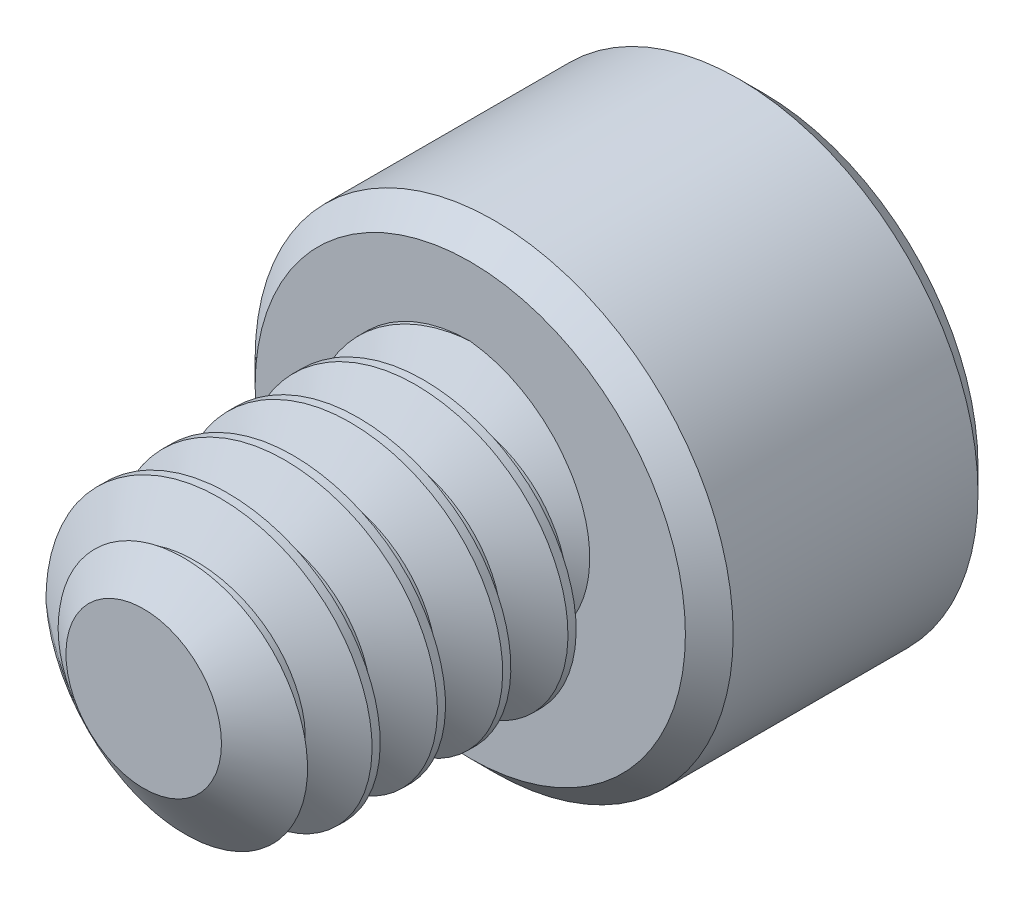
from build123d import *

# Parameters (mm, degrees)
SKETCH1_R          = 1.4224
EXTRUDE1_DEPTH     = 3.175
CUT_SWEEP1_PITCH   = 0.635
SKETCH6_R          = 2.3241
EXTRUDE2_DEPTH     = 2.8448
CUT_EXTRUDE1_DEPTH = 1.7859375
CHAMFER1_SIZE      = 0.23241


with BuildPart() as part:
    # Sketch1 → Extrude1 (new body)
    with BuildSketch(Plane.XY):
        Circle(SKETCH1_R)
    extrude(amount=-EXTRUDE1_DEPTH)

    # Cut-Sweep1: the profile of Sketch3 profile screwed along a right-hand helix of 6 turns, 6 arcs to a turn; built about Z, then put on its axis
    cut_sweep1_z = Axis((0, 0, 0), (0, 0, 1))
    cut_sweep1_corners = [(1.4227, 0, -0.555798205), (1.009955401, 0, -0.3175), (1.009955401, 0, -0.238125), (1.4227, 0, 0.000173205)]
    with BuildLine(mode=Mode.PRIVATE) as cut_sweep1_profile:
        Line(cut_sweep1_corners[0], cut_sweep1_corners[1])
        Line(cut_sweep1_corners[1], cut_sweep1_corners[2])
        Line(cut_sweep1_corners[2], cut_sweep1_corners[3])
        Line(cut_sweep1_corners[3], cut_sweep1_corners[0])
    cut_sweep1_cap = Face(cut_sweep1_profile.wire())
    cut_sweep1_turn_angles = [0, 30, 60, 90, 120, 150, 180, 210, 240, 270, 300, 330, 360]
    cut_sweep1_turn_weights = [1, 0.8660254037844387, 1, 0.8660254037844387, 1, 0.8660254037844387, 1, 0.8660254037844387, 1, 0.8660254037844387, 1, 0.8660254037844387, 1]
    cut_sweep1_turn_rails = [Edge.make_bspline([Vector(p[0], p[1], 0).rotate(cut_sweep1_z, cut_sweep1_turn_angles[k]) / cut_sweep1_turn_weights[k] + Vector(0, 0, p[2] + CUT_SWEEP1_PITCH * cut_sweep1_turn_angles[k] / 360) for k in range(13)], [0, 0, 0, 1, 1, 2, 2, 3, 3, 4, 4, 5, 5, 6, 6, 6], 2, cut_sweep1_turn_weights) for p in cut_sweep1_corners]
    cut_sweep1_turn_sides = [Face.make_surface_from_curves(cut_sweep1_turn_rails[p[0]], cut_sweep1_turn_rails[p[1]]) for p in [(0, 1), (1, 2), (2, 3), (3, 0)]]
    cut_sweep1 = Plane(origin=(0, 0, 0), x_dir=(0, 1, 0), z_dir=(0, 0, -1)) * Solid(Shell([*[p.moved(Location((0, 0, CUT_SWEEP1_PITCH * i))) for i in range(6) for p in cut_sweep1_turn_sides], cut_sweep1_cap, cut_sweep1_cap.rotate(cut_sweep1_z, 2160).moved(Location((0, 0, CUT_SWEEP1_PITCH * 2160 / 360)))]))
    add(cut_sweep1, mode=Mode.SUBTRACT)

    # Sketch4 → Cut-Revolve1 (revolve, cut)
    with BuildSketch(Plane(origin=(0, 0, 0), x_dir=(0, 0, -1), z_dir=(1, 0, 0)), mode=Mode.PRIVATE) as cut_revolve1_sk:
        Polygon((0.466649532, 1.4224), (0, 0.755955401), (0, 1.4224), align=None)
    revolve(cut_revolve1_sk.sketch.rotate(Axis((0, 0, 0), (0, 0, -1)), 264.795368264), axis=Axis((0, 0, 0), (0, 0, -1)), mode=Mode.SUBTRACT)

    # Sketch6 → Extrude2 (add)
    with BuildSketch(Plane(origin=(0, 0, -3.175), x_dir=(-1, 0, 0), z_dir=(0, 0, -1))):
        Circle(SKETCH6_R)
    extrude(amount=EXTRUDE2_DEPTH)

    # Sketch7 → Cut-Extrude1 (cut)
    with BuildSketch(Plane(origin=(0, 0, -6.0198), x_dir=(-1, 0, 0), z_dir=(0, 0, -1))):
        Polygon((0, 1.374815329), (-1.190625, 0.687407664), (-1.190625, -0.687407664), (0, -1.374815329), (1.190625, -0.687407664), (1.190625, 0.687407664), align=None)
    extrude(amount=-CUT_EXTRUDE1_DEPTH, mode=Mode.SUBTRACT)

    # Cut-Extrude2 cone 1 section (through the dimple's axis) → Cut-Extrude2 (revolve, cut)
    with BuildSketch(Plane(origin=(0, 0, -6.0198), x_dir=(0, 1, 0), z_dir=(1, 0, 0))):
        Polygon((0, 0), (1.374815329, 0), (0, 1.374815329), align=None)
    revolve(axis=Axis((0, 0, -6.0198), (0, 0, 1)), mode=Mode.SUBTRACT)

    # Chamfer1
    chamfer1_edges = [part.edges().sort_by_distance(p)[0] for p in [
        (2.3241, 0, -3.175),
        (2.3241, 0, -6.0198),
    ]]
    chamfer(chamfer1_edges, length=CHAMFER1_SIZE)


solid = part.part
